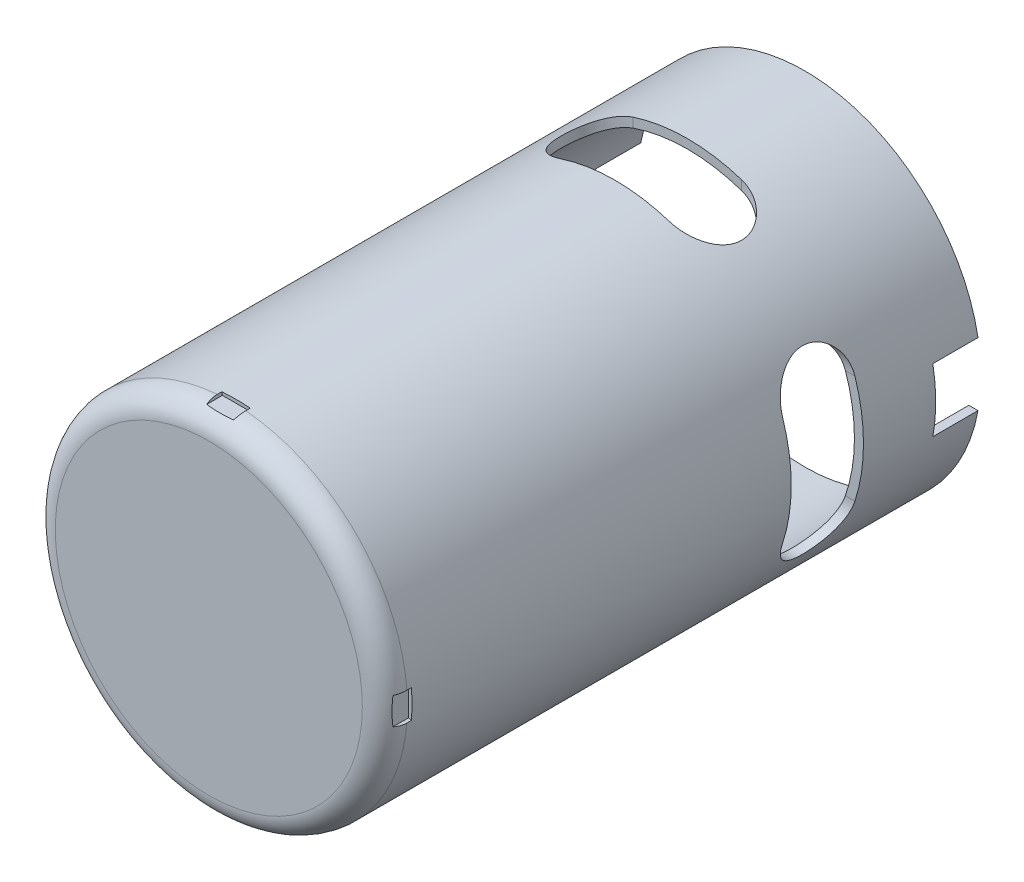
from build123d import *

# Parameters (mm, degrees)
SKETCH1_R               = 19.5
BOSS_EXTRUDE1_DEPTH     = 66
FILLET1_R               = 2.5
CUT_EXTRUDE1_START      = -3
CUT_EXTRUDE1_DEPTH      = 3
SHELL2_DEPTH            = 63.4999999
SHELL2_2_DEPTH          = 62
SHELL2_START            = 63.5
SHELL2_4_DEPTH          = 1.5
CUT_EXTRUDE3_DEPTH      = 58
CUT_EXTRUDE3_DEPTH_BACK = 35
SKETCH3_W               = 5
SKETCH3_H               = 7
CUT_EXTRUDE4_START      = -72.529714198
CUT_EXTRUDE4_DEPTH      = 110.529714198
CIRPATTERN1_COUNT       = 4


with BuildPart() as part:
    # Sketch1 → Boss-Extrude1 (new body)
    with BuildSketch(Plane.XY):
        Circle(SKETCH1_R)
    extrude(amount=BOSS_EXTRUDE1_DEPTH)

    # Fillet1
    fillet1_edges = [part.edges().sort_by_distance(p)[0] for p in [
        (-19.5, 0, 66),
    ]]
    fillet(fillet1_edges, radius=FILLET1_R)

    # Sketch2 → Cut-Extrude1 (cut)
    with BuildSketch(Plane.XY.offset(66).offset(CUT_EXTRUDE1_START)):
        with BuildLine():
            Line((-1.5, 19.118888008), (1.5, 19.118888008))
            Line((1.5, 19.118888008), (1.583181577, 19.435625436))
            ThreePointArc((1.583181577, 19.435625436), (0.012388968, 19.499996064), (-1.558484165, 19.437621436))
            Line((-1.558484165, 19.437621436), (-1.5, 19.118888008))
        make_face()
        with BuildLine():
            Line((19.118888008, 1.5), (19.118888008, -1.5))
            Line((19.118888008, -1.5), (19.435625436, -1.583181577))
            ThreePointArc((19.435625436, -1.583181577), (19.499996064, -0.012388968), (19.437621436, 1.558484165))
            Line((19.437621436, 1.558484165), (19.118888008, 1.5))
        make_face()
        with BuildLine():
            Line((1.5, -19.118888008), (-1.5, -19.118888008))
            Line((-1.5, -19.118888008), (-1.583181577, -19.435625436))
            ThreePointArc((-1.583181577, -19.435625436), (-0.012388968, -19.499996064), (1.558484165, -19.437621436))
            Line((1.558484165, -19.437621436), (1.5, -19.118888008))
        make_face()
        with BuildLine():
            Line((-19.118888008, -1.5), (-19.118888008, 1.5))
            Line((-19.118888008, 1.5), (-19.435625436, 1.583181577))
            ThreePointArc((-19.435625436, 1.583181577), (-19.499996064, 0.012388968), (-19.437621436, -1.558484165))
            Line((-19.437621436, -1.558484165), (-19.118888008, -1.5))
        make_face()
    extrude(amount=CUT_EXTRUDE1_DEPTH, mode=Mode.SUBTRACT)

    # Shell2: read off the stored shape, not the designer's step
    # Shell2 outline → Shell2 (cut)
    with BuildSketch(Plane.XY):
        with BuildLine():
            Line((18.118888008, 2.333205524), (18.346911442, 2.375045379))
            ThreePointArc((18.346911442, 2.375045379), (13.066338109, 13.096595298), (2.332603018, 18.352355793))
            Line((2.332603018, 18.352355793), (2.271289713, 18.118888008))
            Line((2.271289713, 18.118888008), (-2.333205524, 18.118888008))
            Line((-2.333205524, 18.118888008), (-2.375045379, 18.346911442))
            ThreePointArc((-2.375045379, 18.346911442), (-13.096595298, 13.066338109), (-18.352355793, 2.332603018))
            Line((-18.352355793, 2.332603018), (-18.118888008, 2.271289713))
            Line((-18.118888008, 2.271289713), (-18.118888008, -2.333205524))
            Line((-18.118888008, -2.333205524), (-18.346911442, -2.375045379))
            ThreePointArc((-18.346911442, -2.375045379), (-13.066338109, -13.096595298), (-2.332603018, -18.352355793))
            Line((-2.332603018, -18.352355793), (-2.271289713, -18.118888008))
            Line((-2.271289713, -18.118888008), (2.333205524, -18.118888008))
            Line((2.333205524, -18.118888008), (2.375045379, -18.346911442))
            ThreePointArc((2.375045379, -18.346911442), (13.096595298, -13.066338109), (18.352355793, -2.332603018))
            Line((18.352355793, -2.332603018), (18.118888008, -2.271289713))
            Line((18.118888008, -2.271289713), (18.118888008, 2.333205524))
        make_face()
    extrude(amount=SHELL2_DEPTH, mode=Mode.SUBTRACT)

    # Shell2 2 outline → Shell2 2 (cut)
    with BuildSketch(Plane.XY):
        with BuildLine():
            ThreePointArc((18.352355793, -2.332603018), (18.499987628, 0.021395063), (18.346911442, 2.375045379))
            Line((18.346911442, 2.375045379), (18.118888008, 2.333205524))
            Line((18.118888008, 2.333205524), (18.118888008, -2.271289713))
            Line((18.118888008, -2.271289713), (18.352355793, -2.332603018))
        make_face()
        with BuildLine():
            Line((2.271289713, 18.118888008), (2.332603018, 18.352355793))
            ThreePointArc((2.332603018, 18.352355793), (-0.021395063, 18.499987628), (-2.375045379, 18.346911442))
            Line((-2.375045379, 18.346911442), (-2.333205524, 18.118888008))
            Line((-2.333205524, 18.118888008), (2.271289713, 18.118888008))
        make_face()
        with BuildLine():
            ThreePointArc((-2.332603018, -18.352355793), (0.021395063, -18.499987628), (2.375045379, -18.346911442))
            Line((2.375045379, -18.346911442), (2.333205524, -18.118888008))
            Line((2.333205524, -18.118888008), (-2.271289713, -18.118888008))
            Line((-2.271289713, -18.118888008), (-2.332603018, -18.352355793))
        make_face()
        with BuildLine():
            Line((-18.118888008, 2.271289713), (-18.352355793, 2.332603018))
            ThreePointArc((-18.352355793, 2.332603018), (-18.499987628, -0.021395063), (-18.346911442, -2.375045379))
            Line((-18.346911442, -2.375045379), (-18.118888008, -2.333205524))
            Line((-18.118888008, -2.333205524), (-18.118888008, 2.271289713))
        make_face()
    extrude(amount=SHELL2_2_DEPTH, mode=Mode.SUBTRACT)

    # Shell2 3 outline → Shell2 3 (revolve, cut)
    with BuildSketch(Plane.XZ):
        with BuildLine():
            Line((17, 65), (0, 65))
            Line((0, 65), (0, 63.5))
            Line((0, 63.5), (18.5, 63.5))
            ThreePointArc((18.5, 63.5), (18.060660172, 64.560660172), (17, 65))
        make_face()
    revolve(axis=Axis((0, 0, 0), (0, 0, 1)), mode=Mode.SUBTRACT)

    # Shell2 4 outline → Shell2 4 (add)
    with BuildSketch(Plane.XY.offset(SHELL2_START)):
        with BuildLine():
            ThreePointArc((2.332603018, 18.352355793), (-0.021395063, 18.499987628), (-2.375045379, 18.346911442))
            Line((-2.375045379, 18.346911442), (-2.333205524, 18.118888008))
            Line((-2.333205524, 18.118888008), (2.271289713, 18.118888008))
            Line((2.271289713, 18.118888008), (2.332603018, 18.352355793))
        make_face()
        with BuildLine():
            Line((-18.118888008, 2.271289713), (-18.352355793, 2.332603018))
            ThreePointArc((-18.352355793, 2.332603018), (-18.499987628, -0.021395063), (-18.346911442, -2.375045379))
            Line((-18.346911442, -2.375045379), (-18.118888008, -2.333205524))
            Line((-18.118888008, -2.333205524), (-18.118888008, 2.271289713))
        make_face()
        with BuildLine():
            ThreePointArc((18.352355793, -2.332603018), (18.499987628, 0.021395063), (18.346911442, 2.375045379))
            Line((18.346911442, 2.375045379), (18.118888008, 2.333205524))
            Line((18.118888008, 2.333205524), (18.118888008, -2.271289713))
            Line((18.118888008, -2.271289713), (18.352355793, -2.332603018))
        make_face()
        with BuildLine():
            Line((-2.271289713, -18.118888008), (-2.332603018, -18.352355793))
            ThreePointArc((-2.332603018, -18.352355793), (0.021395063, -18.499987628), (2.375045379, -18.346911442))
            Line((2.375045379, -18.346911442), (2.333205524, -18.118888008))
            Line((2.333205524, -18.118888008), (-2.271289713, -18.118888008))
        make_face()
    extrude(amount=SHELL2_4_DEPTH)

    # Sketch3 → Cut-Extrude3 (cut, two sides: drawn at the far end of the back side and taken through both)
    with BuildSketch(Plane(origin=(0, 0, 0), x_dir=(0, 0, -1), z_dir=(1, 0, 0)).offset(-CUT_EXTRUDE3_DEPTH_BACK)):
        with Locations((-2.5, 0)):
            Rectangle(SKETCH3_W, SKETCH3_H)
    extrude(amount=CUT_EXTRUDE3_DEPTH + CUT_EXTRUDE3_DEPTH_BACK, mode=Mode.SUBTRACT)

    # Sketch4 → Cut-Extrude4 (cut)
    with BuildSketch(Plane(origin=(0, 0, 0), x_dir=(1, 0, 0), z_dir=(0, 1, 0)).offset(CUT_EXTRUDE4_START)):
        with BuildLine():
            Line((-6, -13), (6, -13))
            ThreePointArc((6, -13), (10, -17), (6, -21))
            Line((6, -21), (-6, -21))
            ThreePointArc((-6, -21), (-10, -17), (-6, -13))
        make_face()
    cut_extrude4 = extrude(amount=CUT_EXTRUDE4_DEPTH, mode=Mode.SUBTRACT)

    # CirPattern1: Cut-Extrude4 ×4 about axis
    cirpattern1_axis = Axis((0, 0, 66), (0, 0, 1))
    for i in range(1, CIRPATTERN1_COUNT):
        add(cut_extrude4.rotate(cirpattern1_axis, i * 360 / CIRPATTERN1_COUNT), mode=Mode.SUBTRACT)


solid = part.part
